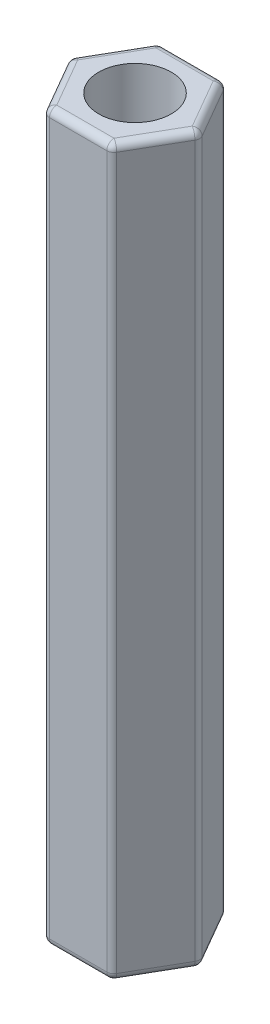
from build123d import *

# Parameters (mm, degrees)
SKETCH_1_R      = 1.5
EXTRUDE_1_DEPTH = 30
FILLET_1_R      = 0.3


with BuildPart() as part:
    # 草图1 → 凸台-拉伸1 (new body)
    with BuildSketch(Plane(origin=(0, 0, 0), x_dir=(1, 0, 0), z_dir=(0, 1, 0))):
        Polygon((2.713546265, 0), (1.356773133, 2.35), (-1.356773133, 2.35), (-2.713546265, 0), (-1.356773133, -2.35), (1.356773133, -2.35), align=None)
        Circle(SKETCH_1_R, mode=Mode.SUBTRACT)
    extrude(amount=EXTRUDE_1_DEPTH)

    # 圆角1
    fillet_1_edges = [part.edges().sort_by_distance(p)[0] for p in [
        (2.713546265, 15, 0),
        (1.356773133, 15, -2.35),
        (-1.356773133, 15, -2.35),
        (-2.713546265, 15, 0),
        (-1.356773133, 15, 2.35),
        (1.356773133, 15, 2.35),
        (0, 30, 2.35),
        (-2.035159699, 30, 1.175),
        (-2.035159699, 30, -1.175),
        (0, 30, -2.35),
        (2.035159699, 30, -1.175),
        (2.035159699, 30, 1.175),
        (0, 0, 2.35),
        (-2.035159699, 0, 1.175),
        (-2.035159699, 0, -1.175),
        (0, 0, -2.35),
        (2.035159699, 0, -1.175),
        (2.035159699, 0, 1.175),
    ]]
    fillet(fillet_1_edges, radius=FILLET_1_R)


solid = part.part
